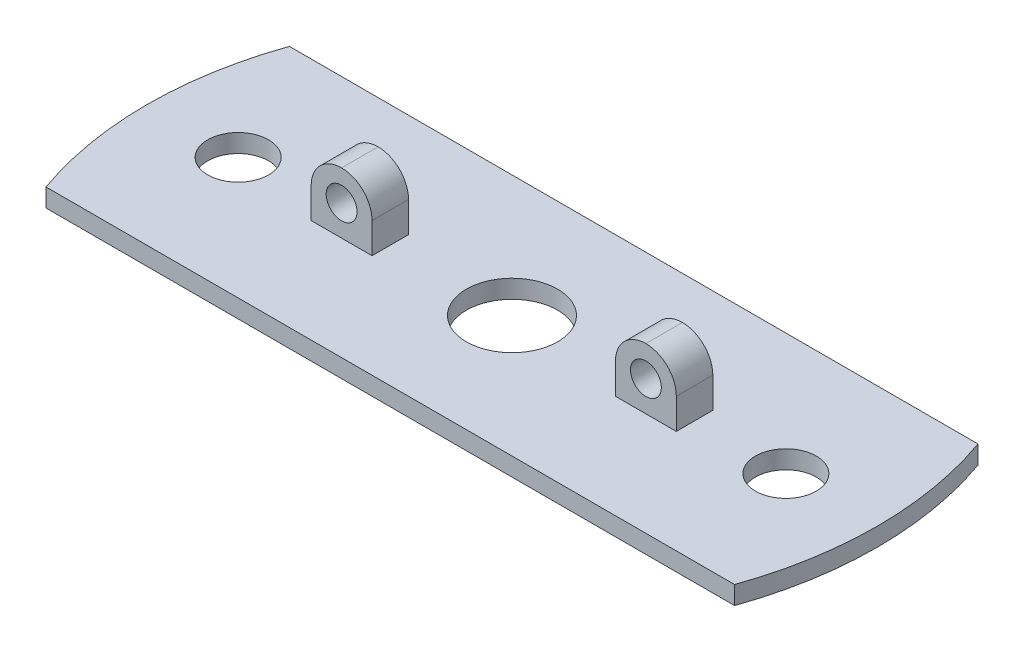
from build123d import *

# Parameters (mm, degrees)
SCHIZZO1_R                   = 5
SCHIZZO1_R_2                 = 7.5
ESTRUSIONE_ESTRUSIONE1_DEPTH = 3
SCHIZZO3_W                   = 10
SCHIZZO3_H                   = 6
ESTRUSIONE_ESTRUSIONE2_DEPTH = 10
SCHIZZO4_R                   = 2.534735547
TAGLIO_ESTRUSIONE1_DEPTH     = 9
RACCORDO1_R                  = 5
RACCORDO1_OF_SPECCHIA1_R     = 5


with BuildPart() as part:
    # Schizzo1 → Estrusione-Estrusione1 (new body)
    with BuildSketch(Plane(origin=(0, 0, 0), x_dir=(1, 0, 0), z_dir=(0, 1, 0))):
        with BuildLine():
            Line((-56.568542495, 20), (56.568542495, 20))
            ThreePointArc((56.568542495, 20), (60, 0), (56.568542495, -20))
            Line((56.568542495, -20), (-56.568542495, -20))
            ThreePointArc((-56.568542495, -20), (-60, 0), (-56.568542495, 20))
        make_face()
        with Locations(Location((45, 0, 0), (0, 0, 270))):
            Circle(SCHIZZO1_R, mode=Mode.SUBTRACT)
        with Locations(Location((-45, 0, 0), (0, 0, 270))):
            Circle(SCHIZZO1_R, mode=Mode.SUBTRACT)
        with Locations(Location((0, 0, 0), (0, 0, 270))):
            Circle(SCHIZZO1_R_2, mode=Mode.SUBTRACT)
    extrude(amount=ESTRUSIONE_ESTRUSIONE1_DEPTH)

    # Schizzo3 → Estrusione-Estrusione2 (add)
    with BuildSketch(Plane(origin=(0, 3, 0), x_dir=(1, 0, 0), z_dir=(0, 1, 0))):
        with Locations((-25, 0)):
            Rectangle(SCHIZZO3_W, SCHIZZO3_H)
    estrusione_estrusione2 = extrude(amount=ESTRUSIONE_ESTRUSIONE2_DEPTH)

    # Schizzo4 → Taglio-Estrusione1 (cut)
    with BuildSketch(Plane.XY.offset(3)):
        with Locations((-25, 8)):
            Circle(SCHIZZO4_R)
    taglio_estrusione1 = extrude(amount=-TAGLIO_ESTRUSIONE1_DEPTH, mode=Mode.SUBTRACT)

    # Raccordo1
    raccordo1_edges = [part.edges().sort_by_distance(p)[0] for p in [
        (-20, 13, 0),
        (-30, 13, 0),
    ]]
    fillet(raccordo1_edges, radius=RACCORDO1_R - 0.0001)  # a hair under: the kernel refuses the full size

    # Specchia1: Estrusione-Estrusione2, Taglio-Estrusione1 across plane
    add(estrusione_estrusione2.mirror(Plane(origin=(0, 0, 0), x_dir=(0, 0, 1), z_dir=(1, 0, 0))))
    add(taglio_estrusione1.mirror(Plane(origin=(0, 0, 0), x_dir=(0, 0, 1), z_dir=(1, 0, 0))), mode=Mode.SUBTRACT)

    # Raccordo1 of Specchia1
    raccordo1_of_specchia1_edges = [part.edges().sort_by_distance(p)[0] for p in [
        (20, 13, 0),
        (30, 13, 0),
    ]]
    fillet(raccordo1_of_specchia1_edges, radius=RACCORDO1_OF_SPECCHIA1_R - 0.0001)  # a hair under: the kernel refuses the full size


solid = part.part
